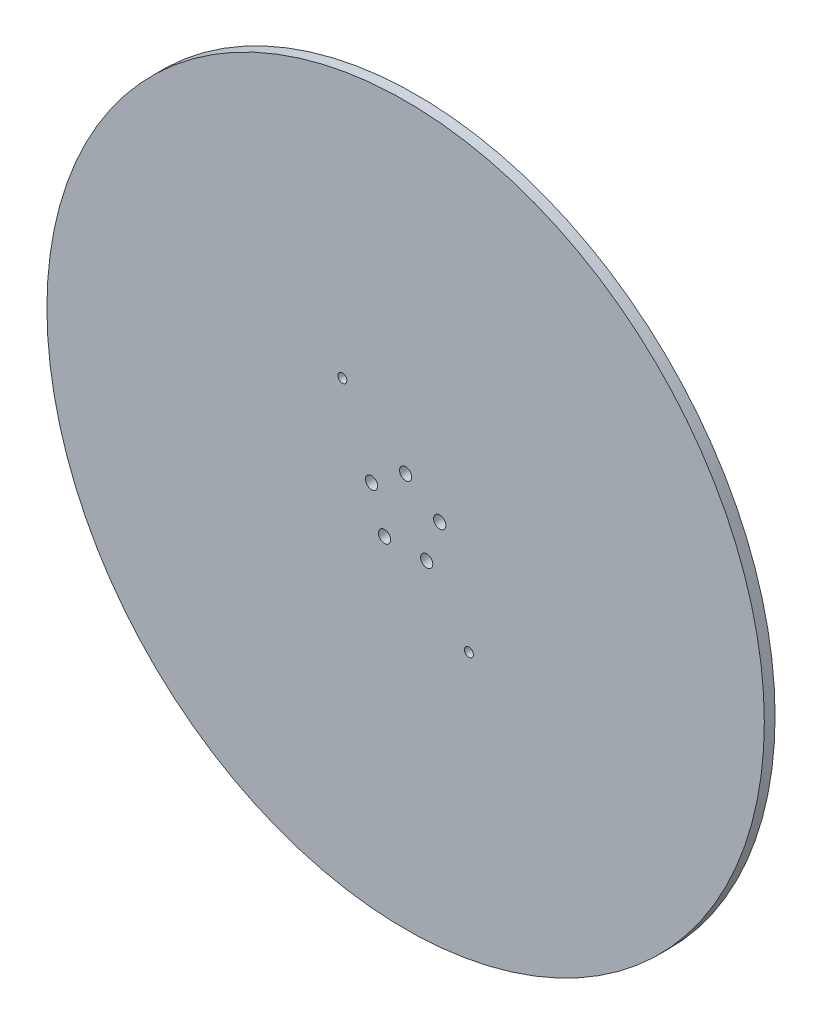
from build123d import *

# Parameters (mm, degrees)
ESQUISSE1_R              = 100
BOSS_EXTRU_1_DEPTH       = 3
D_GAGEMENT_M31_OUTLINE_R = 1.7
D_GAGEMENT_M31_DEPTH     = 3
ENL_V_MAT_EXTRU_1_REACH  = 143.453
ESQUISSE5_R              = 1.25


# Read off the part's stored shape, not the designer's step: Dégagement M31
with BuildPart() as part:
    # Esquisse1 → Boss.-Extru.1 (new body)
    with BuildSketch(Plane.XY):
        Circle(ESQUISSE1_R)
    extrude(amount=BOSS_EXTRU_1_DEPTH)

    # Dégagement M31 outline → Dégagement M31 (cut)
    with BuildSketch(Plane.XY):
        with Locations((9.510565163, 3.090169944)):
            Circle(D_GAGEMENT_M31_OUTLINE_R)
        with Locations((5.877852523, -8.090169944)):
            Circle(D_GAGEMENT_M31_OUTLINE_R)
        with Locations((-5.877852523, -8.090169944)):
            Circle(D_GAGEMENT_M31_OUTLINE_R)
        with Locations((-9.510565163, 3.090169944)):
            Circle(D_GAGEMENT_M31_OUTLINE_R)
        with Locations((0, 10)):
            Circle(D_GAGEMENT_M31_OUTLINE_R)
    extrude(amount=D_GAGEMENT_M31_DEPTH, mode=Mode.SUBTRACT)

    # Esquisse5 → Enlèv. mat.-Extru.1 (cut, up to next)
    with BuildSketch(Plane.XY.offset(3), mode=Mode.PRIVATE) as enl_v_mat_extru_1_sk1:
        with Locations((17.633557569, -24.270509831)):
            Circle(ESQUISSE5_R)
    enl_v_mat_extru_1_tool1 = extrude(enl_v_mat_extru_1_sk1.sketch, amount=-ENL_V_MAT_EXTRU_1_REACH, mode=Mode.PRIVATE) & part.part
    # Esquisse5 → Enlèv. mat.-Extru.1 (cut, up to next)
    with BuildSketch(Plane.XY.offset(3), mode=Mode.PRIVATE) as enl_v_mat_extru_1_sk2:
        with Locations((-17.633557569, 24.270509831)):
            Circle(ESQUISSE5_R)
    enl_v_mat_extru_1_tool2 = extrude(enl_v_mat_extru_1_sk2.sketch, amount=-ENL_V_MAT_EXTRU_1_REACH, mode=Mode.PRIVATE) & part.part
    add(enl_v_mat_extru_1_tool1.solids().sort_by_distance((17.633558, -24.27051, 3))[0], mode=Mode.SUBTRACT)
    add(enl_v_mat_extru_1_tool2.solids().sort_by_distance((-17.633558, 24.27051, 3))[0], mode=Mode.SUBTRACT)


solid = part.part
